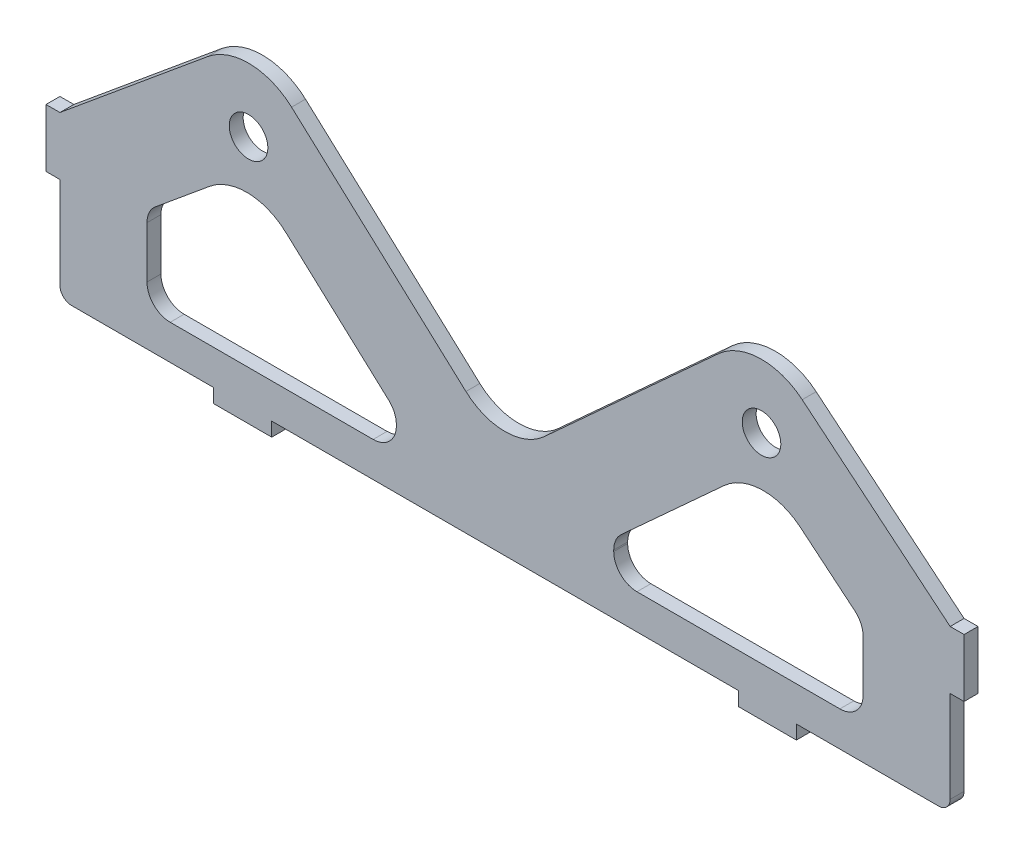
from build123d import *

# Parameters (mm, degrees)
SKETCH1_R            = 4.22275
BOSS_EXTRUDE1_DEPTH  = 3.048
FILLET1_R            = 12.7
CUT_EXTRUDE1_DEPTH   = 120.852046006
FILLET2_R            = 5.08
FILLET2_OF_MIRROR1_R = 5.08


with BuildPart() as part:
    # Sketch1 → Boss-Extrude1 (new body)
    with BuildSketch(Plane.XY):
        with BuildLine():
            Line((-51.054, 0), (51.054, 0))
            Line((51.054, 0), (51.054, -3.048))
            Line((51.054, -3.048), (63.754, -3.048))
            Line((63.754, -3.048), (63.754, 0))
            Line((63.754, 0), (94.861600757, 0))
            ThreePointArc((94.861600757, 0), (96.657651981, 0.743948776), (97.401600757, 2.54))
            Line((97.401600757, 2.54), (97.401600757, 22.606))
            Line((97.401600757, 22.606), (100.449600757, 22.606))
            Line((100.449600757, 22.606), (100.449600757, 35.306))
            Line((100.449600757, 35.306), (97.401600757, 35.306))
            Line((97.401600757, 35.306), (65.034740931, 62.09905242))
            ThreePointArc((65.034740931, 62.09905242), (55.791114337, 65.303706753), (46.712023238, 61.658909525))
            Line((46.712023238, 61.658909525), (0, 19.05))
            Line((0, 19.05), (-46.712023238, 61.658909525))
            ThreePointArc((-46.712023238, 61.658909525), (-55.791114337, 65.303706753), (-65.034740931, 62.09905242))
            Line((-65.034740931, 62.09905242), (-97.401600757, 35.306))
            Line((-97.401600757, 35.306), (-100.449600757, 35.306))
            Line((-100.449600757, 35.306), (-100.449600757, 22.606))
            Line((-100.449600757, 22.606), (-97.401600757, 22.606))
            Line((-97.401600757, 22.606), (-97.401600757, 2.54))
            ThreePointArc((-97.401600757, 2.54), (-96.657651981, 0.743948776), (-94.861600757, 0))
            Line((-94.861600757, 0), (-63.754, 0))
            Line((-63.754, 0), (-63.754, -3.048))
            Line((-63.754, -3.048), (-51.054, -3.048))
            Line((-51.054, -3.048), (-51.054, 0))
        make_face()
        with Locations((-56.126600757, 51.33773565)):
            Circle(SKETCH1_R, mode=Mode.SUBTRACT)
        with Locations((56.126600757, 51.33773565)):
            Circle(SKETCH1_R, mode=Mode.SUBTRACT)
    extrude(amount=-BOSS_EXTRUDE1_DEPTH)

    # Fillet1
    fillet1_edges = [part.edges().sort_by_distance(p)[0] for p in [
        (0, 19.05, -1.524),
    ]]
    fillet(fillet1_edges, radius=FILLET1_R)

    # Sketch3 → Cut-Extrude1 (cut, symmetric)
    with BuildSketch(Plane.XY):
        with BuildLine():
            Line((-64.628984538, 37.704829039), (-78.351600757, 26.345346603))
            Line((-78.351600757, 26.345346603), (-78.351600757, 7.62))
            Line((-78.351600757, 7.62), (-23.782503148, 7.62))
            Line((-23.782503148, 7.62), (-23.782503148, 15.24))
            Line((-23.782503148, 15.24), (-47.971968454, 37.304699134))
            ThreePointArc((-47.971968454, 37.304699134), (-56.225687634, 40.61815116), (-64.628984538, 37.704829039))
        make_face()
    cut_extrude1 = extrude(amount=CUT_EXTRUDE1_DEPTH, both=True, mode=Mode.SUBTRACT)

    # Fillet2
    fillet2_edges = [part.edges().sort_by_distance(p)[0] for p in [
        (-78.351600757, 7.62, -1.524),
        (-23.782503148, 7.62, -1.524),
        (-23.782503148, 15.24, -1.524),
        (-78.351600757, 26.345346603, -1.524),
    ]]
    fillet(fillet2_edges, radius=FILLET2_R)

    # Mirror1: Cut-Extrude1 across plane
    add(cut_extrude1.mirror(Plane(origin=(0, 0, 0), x_dir=(0, 0, 1), z_dir=(1, 0, 0))), mode=Mode.SUBTRACT)

    # Fillet2 of Mirror1
    fillet2_of_mirror1_edges = [part.edges().sort_by_distance(p)[0] for p in [
        (78.351600757, 7.62, -1.524),
        (23.782503148, 7.62, -1.524),
        (23.782503148, 15.24, -1.524),
        (78.351600757, 26.345346603, -1.524),
    ]]
    fillet(fillet2_of_mirror1_edges, radius=FILLET2_OF_MIRROR1_R)


solid = part.part
